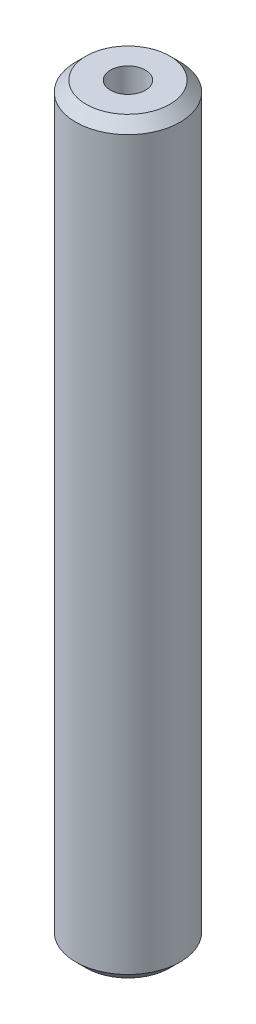
from build123d import *

# Parameters (mm, degrees)
SKETCH1_R           = 10
BOSS_EXTRUDE1_DEPTH = 143.357903294
SKETCH2_R           = 3.349201616
CUT_EXTRUDE1_DEPTH  = 145.053769256
CHAMFER1_SIZE       = 1.980457064


with BuildPart() as part:
    # Sketch1 → Boss-Extrude1 (new body)
    with BuildSketch(Plane(origin=(0, 0, 0), x_dir=(1, 0, 0), z_dir=(0, 1, 0))):
        Circle(SKETCH1_R)
    extrude(amount=BOSS_EXTRUDE1_DEPTH)

    # Sketch2 → Cut-Extrude1 (cut, through all)
    with BuildSketch(Plane(origin=(0, 0, 0), x_dir=(1, 0, 0), z_dir=(0, 1, 0))):
        Circle(SKETCH2_R)
    extrude(amount=CUT_EXTRUDE1_DEPTH, mode=Mode.SUBTRACT)

    # Chamfer1
    chamfer1_edges = [part.edges().sort_by_distance(p)[0] for p in [
        (-10, 143.357903294, 0),
        (-10, 0, 0),
    ]]
    chamfer(chamfer1_edges, length=CHAMFER1_SIZE)


solid = part.part
